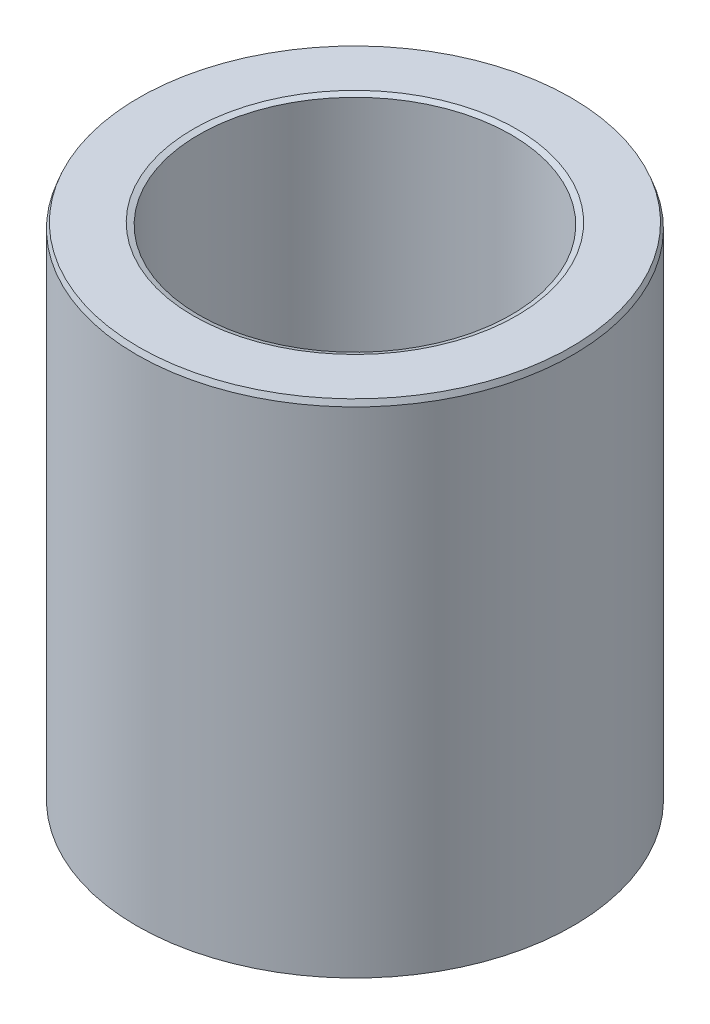
from build123d import *
from OCP.BRepFilletAPI import BRepFilletAPI_MakeChamfer

# Parameters (mm, degrees)
SKETCH1_R           = 15
BOSS_EXTRUDE1_DEPTH = 34.532272487
SKETCH2_R           = 10.737438095
CUT_EXTRUDE1_DEPTH  = 41.527494903
CHAMFER1_SIZE       = 0.383928983
CHAMFER1_SIZE2      = 0.141691512


with BuildPart() as part:
    # Sketch1 → Boss-Extrude1 (new body)
    with BuildSketch(Plane(origin=(0, 0, 0), x_dir=(1, 0, 0), z_dir=(0, 1, 0))):
        Circle(SKETCH1_R)
    extrude(amount=BOSS_EXTRUDE1_DEPTH)

    # Sketch2 → Cut-Extrude1 (cut, through all)
    with BuildSketch(Plane(origin=(0, 0, 0), x_dir=(1, 0, 0), z_dir=(0, 1, 0))):
        Circle(SKETCH2_R)
    extrude(amount=CUT_EXTRUDE1_DEPTH, mode=Mode.SUBTRACT)

    # Chamfer1: one chamfer whose edges measure the first distance from different faces: ONE call of the kernel's chamfer builder (chamfer() names one face for all edges)
    chamfer1_edges_1 = [part.edges().sort_by_distance(p)[0] for p in [
        (-10.737438095, 34.532272487, 0),
    ]]
    chamfer1_side_1 = [part.faces().sort_by_distance(p)[0] for p in [
        (-14.575735931, 34.532272487, 0),
    ]]
    chamfer1_edges_2 = [part.edges().sort_by_distance(p)[0] for p in [
        (-10.737438095, 0, 0),
    ]]
    chamfer1_side_2 = [part.faces().sort_by_distance(p)[0] for p in [
        (-10.737438095, 17.266136244, 0),
    ]]
    chamfer1_edges_3 = [part.edges().sort_by_distance(p)[0] for p in [
        (-15, 0, 0),
    ]]
    chamfer1_side_3 = [part.faces().sort_by_distance(p)[0] for p in [
        (-14.575735931, 0, 0),
    ]]
    chamfer1_edges_4 = [part.edges().sort_by_distance(p)[0] for p in [
        (-15, 34.532272487, 0),
    ]]
    chamfer1_side_4 = [part.faces().sort_by_distance(p)[0] for p in [
        (-15, 17.266136244, 0),
    ]]
    chamfer1 = BRepFilletAPI_MakeChamfer(part.part.solid().wrapped)
    for e in chamfer1_edges_1:
        chamfer1.Add(CHAMFER1_SIZE, CHAMFER1_SIZE2, e.wrapped, chamfer1_side_1[0].wrapped)  # the first distance lies on this face
    for e in chamfer1_edges_2:
        chamfer1.Add(CHAMFER1_SIZE, CHAMFER1_SIZE2, e.wrapped, chamfer1_side_2[0].wrapped)  # the first distance lies on this face
    for e in chamfer1_edges_3:
        chamfer1.Add(CHAMFER1_SIZE, CHAMFER1_SIZE2, e.wrapped, chamfer1_side_3[0].wrapped)  # the first distance lies on this face
    for e in chamfer1_edges_4:
        chamfer1.Add(CHAMFER1_SIZE, CHAMFER1_SIZE2, e.wrapped, chamfer1_side_4[0].wrapped)  # the first distance lies on this face
    add(Compound.cast(chamfer1.Shape()), mode=Mode.REPLACE)


solid = part.part
